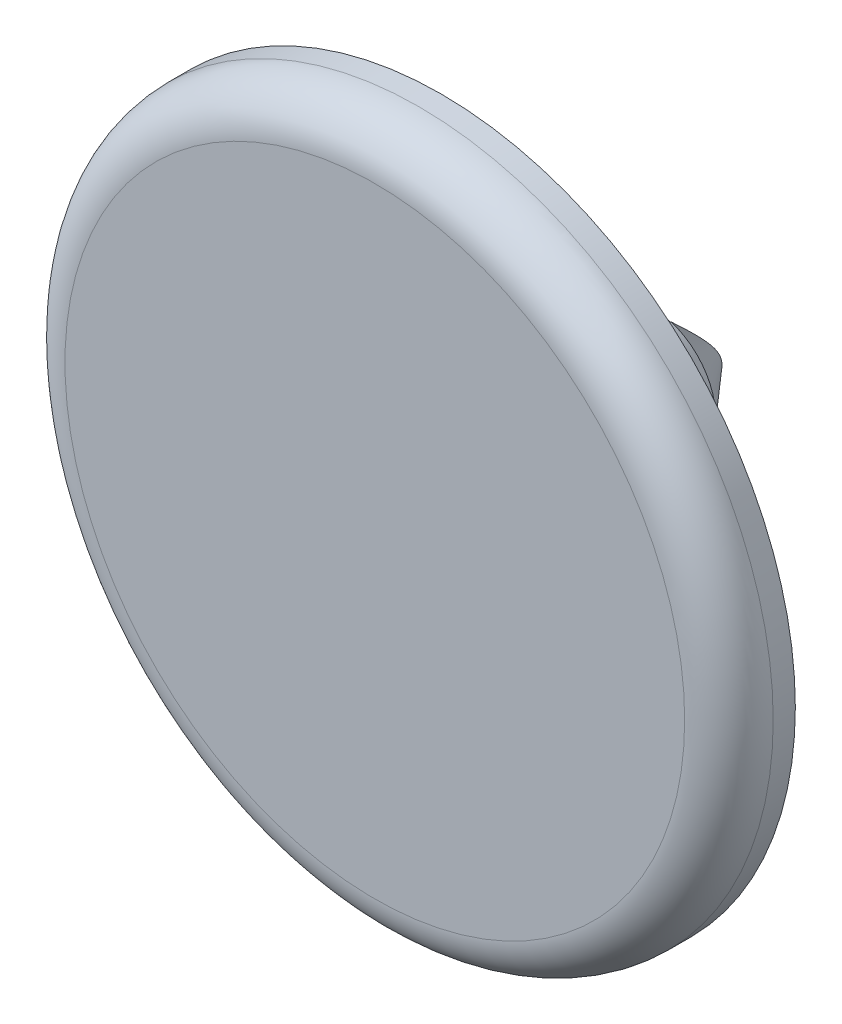
from build123d import *

# Parameters (mm, degrees)
SKETCH_1_R          = 8
EXTRUDE_1_DEPTH     = 1.5
SKETCH_2_R          = 1.55
EXTRUDE_2_DEPTH     = 3.4
FILLET_1_R          = 1
SKETCH_4_R          = 1.75
EXTRUDE_3_DEPTH     = 3
CHAMFER_4_SIZE      = 2
CHAMFER_4_SIZE2     = 1.738573476
FILLET_3_R          = 0.3
SKETCH_5_W          = 1
SKETCH_5_H          = 4.340238852
CUT_EXTRUDE_2_DEPTH = 5.7
CUT_EXTRUDE_2_DRAFT = -3
CHAMFER_5_SIZE      = 0.5
CHAMFER_5_SIZE2     = 0.477191311
CHAMFER_6_SIZE      = 0.5
CHAMFER_6_SIZE2     = 0.477191311


with BuildPart() as part:
    # Эскиз1 → Бобышка-Вытянуть1 (new body)
    with BuildSketch(Plane.XY):
        Circle(SKETCH_1_R)
    extrude(amount=EXTRUDE_1_DEPTH)

    # Эскиз2 → Бобышка-Вытянуть2 (add)
    with BuildSketch(Plane(origin=(0, 0, 0), x_dir=(-1, 0, 0), z_dir=(0, 0, -1))):
        Circle(SKETCH_2_R)
    extrude(amount=EXTRUDE_2_DEPTH)

    # Скругление1
    fillet_1_edges = [part.edges().sort_by_distance(p)[0] for p in [
        (-8, 0, 1.5),
    ]]
    fillet(fillet_1_edges, radius=FILLET_1_R)

    # Эскиз4 → Бобышка-Вытянуть3 (add)
    with BuildSketch(Plane(origin=(0, 0, -3.4), x_dir=(-1, 0, 0), z_dir=(0, 0, -1))):
        Circle(SKETCH_4_R)
    extrude(amount=EXTRUDE_3_DEPTH)

    # Фаска4
    chamfer_4_edges = [part.edges().sort_by_distance(p)[0] for p in [
        (1.75, 0, -6.4),
    ]]
    chamfer_4_side = [part.faces().sort_by_distance(p)[0] for p in [
        (1.75, 0, -4.9),
    ]]
    chamfer(chamfer_4_edges, length=CHAMFER_4_SIZE, length2=CHAMFER_4_SIZE2, reference=chamfer_4_side[0])

    # Скругление3
    fillet_3_edges = [part.edges().sort_by_distance(p)[0] for p in [
        (1.55, 0, 0),
    ]]
    fillet(fillet_3_edges, radius=FILLET_3_R)


with BuildPart() as cut_extrude_2_tool:
    # Эскиз5 → Вырез-Вытянуть2 (with draft: the straight prism first)
    with BuildSketch(Plane(origin=(0, 0, -6.4), x_dir=(-1, 0, 0), z_dir=(0, 0, -1))):
        Rectangle(SKETCH_5_W, SKETCH_5_H)
    extrude(amount=-CUT_EXTRUDE_2_DEPTH)
    # Вырез-Вытянуть2: the draft: its side faces are tilted about the plane it starts from
    cut_extrude_2_sides = [cut_extrude_2_tool.faces().sort_by_distance(p)[0] for p in [
        (0.5, 0, -3.55),
        (0, -2.170119426, -3.55),
        (-0.5, 0, -3.55),
        (0, 2.170119426, -3.55),
    ]]
    draft(cut_extrude_2_sides, Plane(origin=(0, 0, -6.4), x_dir=(-1, 0, 0), z_dir=(0, 0, -1)), CUT_EXTRUDE_2_DRAFT)


with BuildPart() as part_1:
    add(part.part)

    # Вырез-Вытянуть2: cut by cut_extrude_2_tool
    add(cut_extrude_2_tool.part, mode=Mode.SUBTRACT)

    # Фаска5
    chamfer_5_edges = [part_1.edges().sort_by_distance(p)[0] for p in [
        (1.75, 0, -4.4),
    ]]
    chamfer_5_side = [part_1.faces().sort_by_distance(p)[0] for p in [
        (1.107258584, 0, -5.139389418),
    ]]
    chamfer(chamfer_5_edges, length=CHAMFER_5_SIZE, length2=CHAMFER_5_SIZE2, reference=chamfer_5_side[0])

    # Фаска6
    chamfer_6_edges = [part_1.edges().sort_by_distance(p)[0] for p in [
        (-1.75, 0, -4.4),
    ]]
    chamfer_6_side = [part_1.faces().sort_by_distance(p)[0] for p in [
        (-1.111109795, 0, -5.134959107),
    ]]
    chamfer(chamfer_6_edges, length=CHAMFER_6_SIZE, length2=CHAMFER_6_SIZE2, reference=chamfer_6_side[0])


solid = part_1.part
